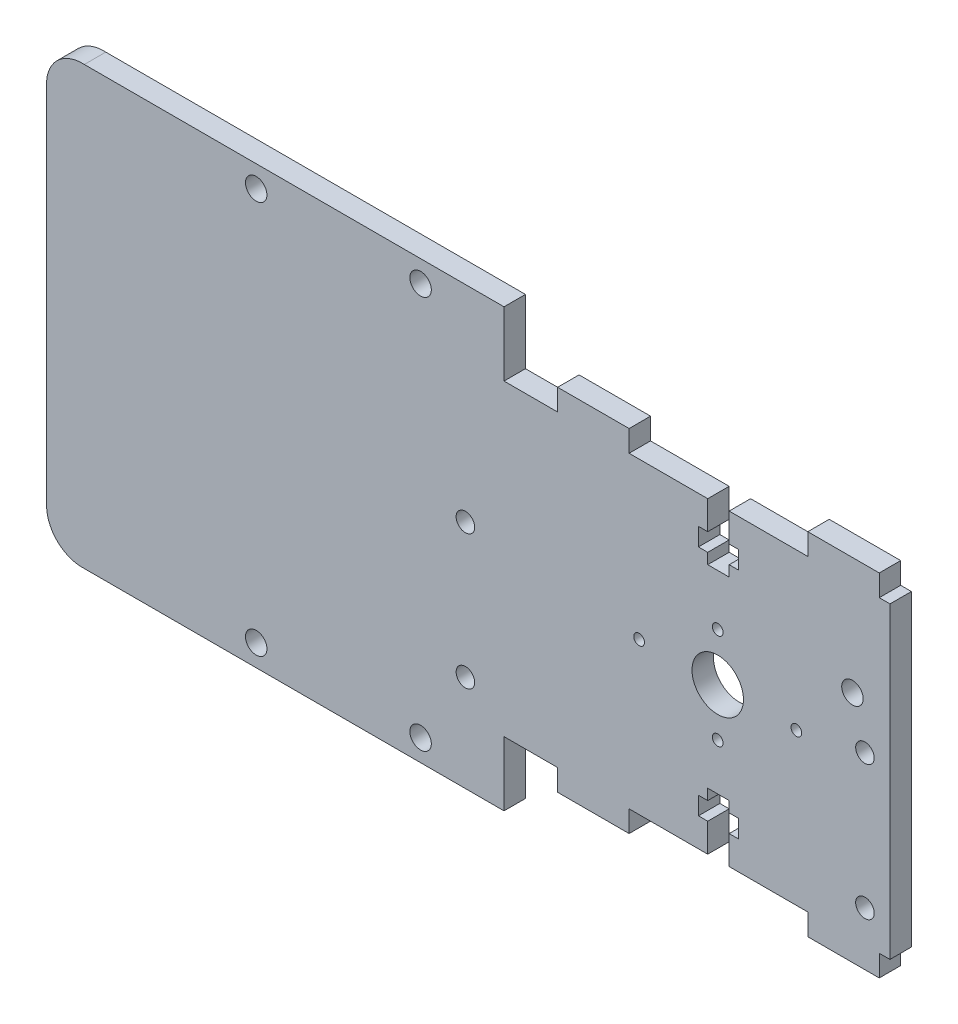
from build123d import *

# Parameters (mm, degrees)
MODEL_R             = 1.5
MODEL_R_2           = 1.3
MODEL_R_3           = 0.75
MODEL_R_4           = 3.6
MODEL_R_5           = 1.500000002
BOSS_EXTRUDE1_DEPTH = 3


with BuildPart() as part:
    # Model → Boss-Extrude1 (new body)
    with BuildSketch(Plane.XY):
        with BuildLine():
            Line((53.808, 64.448), (43.808, 64.448))
            Line((43.808, 64.448), (43.808, 61.448))
            Line((43.808, 61.448), (36.308, 61.448))
            Line((36.308, 61.448), (36.308, 70.448))
            Line((36.308, 70.448), (-22.414233443, 70.448))
            ThreePointArc((-22.414233443, 70.448), (-26.027950405, 69.188749962), (-27.692809934, 65.743041952))
            Line((-27.692809934, 65.743041952), (-27.692809934, 14.360233482))
            ThreePointArc((-27.692809934, 14.360233482), (-26.128440702, 10.72754285), (-22.414233443, 9.368))
            Line((-22.414233443, 9.368), (36.308, 9.368))
            Line((36.308, 9.368), (36.308, 18.368))
            Line((36.308, 18.368), (43.808, 18.368))
            Line((43.808, 18.368), (43.808, 15.368))
            Line((43.808, 15.368), (53.808, 15.368))
            Line((53.808, 15.368), (53.808, 18.368))
            Line((53.808, 18.368), (64.808, 18.368))
            Line((64.808, 18.368), (64.808, 22.368))
            Line((64.808, 22.368), (63.508, 22.368))
            Line((63.508, 22.368), (63.508, 24.868))
            Line((63.508, 24.868), (64.808, 24.868))
            Line((64.808, 24.868), (64.808, 26.368))
            Line((64.808, 26.368), (67.808, 26.368))
            Line((67.808, 26.368), (67.808, 24.868))
            Line((67.808, 24.868), (69.108, 24.868))
            Line((69.108, 24.868), (69.108, 22.368))
            Line((69.108, 22.368), (67.808, 22.368))
            Line((67.808, 22.368), (67.808, 18.368))
            Line((67.808, 18.368), (78.808, 18.368))
            Line((78.808, 18.368), (78.808, 15.368))
            Line((78.808, 15.368), (88.808, 15.368))
            Line((88.808, 15.368), (88.808, 18.368))
            Line((88.808, 18.368), (90.308, 18.368))
            Line((90.308, 18.368), (90.308, 61.448))
            Line((90.308, 61.448), (88.808, 61.448))
            Line((88.808, 61.448), (88.808, 64.448))
            Line((88.808, 64.448), (78.808, 64.448))
            Line((78.808, 64.448), (78.808, 61.448))
            Line((78.808, 61.448), (67.808, 61.448))
            Line((67.808, 61.448), (67.808, 57.4481))
            Line((67.808, 57.4481), (69.108, 57.4481))
            Line((69.108, 57.4481), (69.108, 54.9481))
            Line((69.108, 54.9481), (67.808, 54.9481))
            Line((67.808, 54.9481), (67.808, 53.448))
            Line((67.808, 53.448), (64.808, 53.448))
            Line((64.808, 53.448), (64.808, 54.9481))
            Line((64.808, 54.9481), (63.508, 54.9481))
            Line((63.508, 54.9481), (63.508, 57.4481))
            Line((63.508, 57.4481), (64.808, 57.4481))
            Line((64.808, 57.4481), (64.808, 61.448))
            Line((64.808, 61.448), (53.808, 61.448))
            Line((53.808, 61.448), (53.808, 64.448))
        make_face()
        with Locations((1.635766557, 12.408)):
            Circle(MODEL_R, mode=Mode.SUBTRACT)
        with Locations((24.635766557, 12.408)):
            Circle(MODEL_R, mode=Mode.SUBTRACT)
        with Locations((30.908, 22.868)):
            Circle(MODEL_R_2, mode=Mode.SUBTRACT)
        with Locations((86.808, 22.868)):
            Circle(MODEL_R_2, mode=Mode.SUBTRACT)
        with Locations((55.207943868, 39.587694441)):
            Circle(MODEL_R_3, mode=Mode.SUBTRACT)
        with Locations((66.20800481, 32.898)):
            Circle(MODEL_R_3, mode=Mode.SUBTRACT)
        with Locations((66.20800481, 39.598049108)):
            Circle(MODEL_R_4, mode=Mode.SUBTRACT)
        with Locations((77.20800481, 39.598049108)):
            Circle(MODEL_R_3, mode=Mode.SUBTRACT)
        with Locations((30.908, 41.668)):
            Circle(MODEL_R_2, mode=Mode.SUBTRACT)
        with Locations((1.635766557, 67.408)):
            Circle(MODEL_R, mode=Mode.SUBTRACT)
        with Locations((24.635766557, 67.408)):
            Circle(MODEL_R, mode=Mode.SUBTRACT)
        with Locations((66.20800481, 46.298)):
            Circle(MODEL_R_3, mode=Mode.SUBTRACT)
        with Locations((86.808, 41.668)):
            Circle(MODEL_R_2, mode=Mode.SUBTRACT)
        with Locations((85.058, 48.068)):
            Circle(MODEL_R_5, mode=Mode.SUBTRACT)
    extrude(amount=BOSS_EXTRUDE1_DEPTH)


solid = part.part
